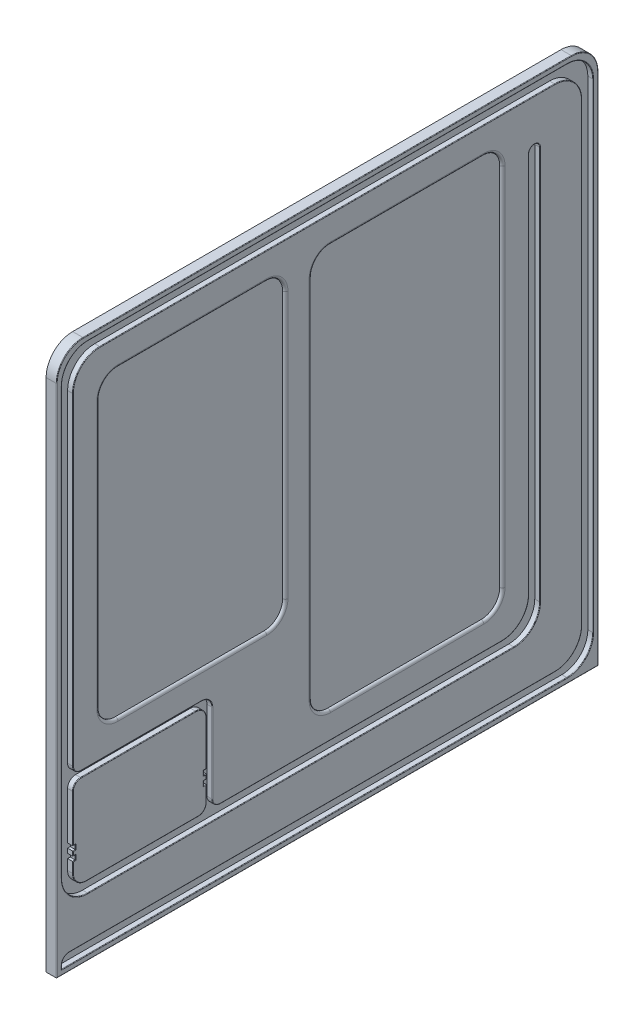
from build123d import *

# Parameters (mm, degrees)
BOSS_EXTRUDE1_DEPTH = 4
CUT_EXTRUDE3_DEPTH  = 2
FILLET1_R           = 0.2
CUT_EXTRUDE4_DEPTH  = 1
FILLET2_R           = 1


with BuildPart() as part:
    # Sketch1 → Boss-Extrude1 (new body)
    with BuildSketch(Plane(origin=(0, 0, 0), x_dir=(0, 0, -1), z_dir=(1, 0, 0))):
        with BuildLine():
            Line((-102, -102), (102, -102))
            Line((102, -102), (102, 92))
            ThreePointArc((102, 92), (99.071067812, 99.071067812), (92, 102))
            Line((92, 102), (-92, 102))
            ThreePointArc((-92, 102), (-99.071067812, 99.071067812), (-102, 92))
            Line((-102, 92), (-102, -102))
        make_face()
    extrude(amount=BOSS_EXTRUDE1_DEPTH)

    # Sketch2 → Cut-Extrude3 (cut)
    with BuildSketch(Plane(origin=(4, 0, 0), x_dir=(0, 0, -1), z_dir=(1, 0, 0))):
        with BuildLine():
            Line((-100.1, 90.3), (-100.1, -70.3))
            ThreePointArc((-100.1, -70.3), (-97.229646456, -77.229646456), (-90.3, -80.1))
            Line((-90.3, -80.1), (70.3, -80.1))
            ThreePointArc((70.3, -80.1), (77.229646456, -77.229646456), (80.1, -70.3))
            Line((80.1, -70.3), (80.1, 78))
            ThreePointArc((80.1, 78), (78, 80.1), (75.9, 78))
            Line((75.9, 78), (75.9, -65.7))
            ThreePointArc((75.9, -65.7), (72.912489168, -72.912489168), (65.7, -75.9))
            Line((65.7, -75.9), (-40.4, -75.9))
            ThreePointArc((-40.4, -75.9), (-42.521320344, -75.021320344), (-43.4, -72.9))
            Line((-43.4, -72.9), (-43.4, -42.9))
            ThreePointArc((-43.4, -42.9), (-44.571572875, -40.071572875), (-47.4, -38.9))
            Line((-47.4, -38.9), (-92.9, -38.9))
            ThreePointArc((-92.9, -38.9), (-95.021320344, -38.021320344), (-95.9, -35.9))
            Line((-95.9, -35.9), (-95.9, 85.7))
            ThreePointArc((-95.9, 85.7), (-92.912489168, 92.912489168), (-85.7, 95.9))
            Line((-85.7, 95.9), (85.7, 95.9))
            ThreePointArc((85.7, 95.9), (92.912489168, 92.912489168), (95.9, 85.7))
            Line((95.9, 85.7), (95.9, -85.7))
            ThreePointArc((95.9, -85.7), (92.912489168, -92.912489168), (85.7, -95.9))
            Line((85.7, -95.9), (-97.3, -95.9))
            ThreePointArc((-97.3, -95.9), (-99.279898987, -96.720101013), (-100.1, -98.7))
            Line((-100.1, -98.7), (-100.1, -100.1))
            Line((-100.1, -100.1), (90.3, -100.1))
            ThreePointArc((90.3, -100.1), (97.229646456, -97.229646456), (100.1, -90.3))
            Line((100.1, -90.3), (100.1, 90.3))
            ThreePointArc((100.1, 90.3), (97.229646456, 97.229646456), (90.3, 100.1))
            Line((90.3, 100.1), (-90.3, 100.1))
            ThreePointArc((-90.3, 100.1), (-97.229646456, 97.229646456), (-100.1, 90.3))
        make_face()
        with BuildLine():
            Line((-90.9, -75.9), (-48.6, -75.9))
            ThreePointArc((-48.6, -75.9), (-46.478679656, -75.021320344), (-45.6, -72.9))
            Line((-45.6, -72.9), (-45.6, -67))
            Line((-45.6, -67), (-46.6, -67))
            Line((-46.6, -67), (-46.6, -65.3))
            Line((-46.6, -65.3), (-45.6, -65.3))
            Line((-45.6, -65.3), (-45.6, -63.6))
            Line((-45.6, -63.6), (-46.6, -63.6))
            Line((-46.6, -63.6), (-46.6, -61.9))
            Line((-46.6, -61.9), (-45.6, -61.9))
            Line((-45.6, -61.9), (-45.6, -45.1))
            ThreePointArc((-45.6, -45.1), (-46.771572875, -42.271572875), (-49.6, -41.1))
            Line((-49.6, -41.1), (-92.9, -41.1))
            ThreePointArc((-92.9, -41.1), (-95.021320344, -41.978679656), (-95.9, -44.1))
            Line((-95.9, -44.1), (-95.9, -61.9))
            Line((-95.9, -61.9), (-94.9, -61.9))
            Line((-94.9, -61.9), (-94.9, -63.6))
            Line((-94.9, -63.6), (-95.9, -63.6))
            Line((-95.9, -63.6), (-95.9, -65.3))
            Line((-95.9, -65.3), (-94.9, -65.3))
            Line((-94.9, -65.3), (-94.9, -67))
            Line((-94.9, -67), (-95.9, -67))
            Line((-95.9, -67), (-95.9, -70.9))
            ThreePointArc((-95.9, -70.9), (-94.435533906, -74.435533906), (-90.9, -75.9))
        make_face(mode=Mode.SUBTRACT)
    extrude(amount=-CUT_EXTRUDE3_DEPTH, mode=Mode.SUBTRACT)

    # Fillet1
    fillet1_edges = [part.edges().sort_by_distance(p)[0] for p in [
        (4, 102, 0),
        (4, 99.071067812, 99.071067812),
        (4, -5, 102),
        (4, -102, 0),
        (4, -5, -102),
        (4, 80.1, -78),
        (4, 6.15, -75.9),
        (4, -72.912489168, -72.912489168),
        (4, -75.9, -12.65),
        (4, -75.021320344, 42.521320344),
        (4, -57.9, 43.4),
        (4, -40.071572875, 44.571572875),
        (4, -38.9, 70.15),
        (4, -38.021320344, 95.021320344),
        (4, 24.9, 95.9),
        (4, 92.912489168, 92.912489168),
        (4, 95.9, 0),
        (4, 92.912489168, -92.912489168),
        (4, 0, -95.9),
        (4, -92.912489168, -92.912489168),
        (4, -95.9, 5.8),
        (4, -96.720101013, 99.279898987),
        (4, -99.4, 100.1),
        (4, -100.1, 4.9),
        (4, -97.229646456, -97.229646456),
        (4, 0, -100.1),
        (4, 97.229646456, -97.229646456),
        (4, 100.1, 0),
        (4, 97.229646456, 97.229646456),
        (4, 10, 100.1),
        (4, -77.229646456, 97.229646456),
        (4, -80.1, 10),
        (4, -77.229646456, -77.229646456),
        (4, 3.85, -80.1),
        (4, -74.435533906, 94.435533906),
        (4, -68.95, 95.9),
        (4, -67, 95.4),
        (4, -66.15, 94.9),
        (4, -65.3, 95.4),
        (4, -64.45, 95.9),
        (4, -63.6, 95.4),
        (4, -62.75, 94.9),
        (4, -61.9, 95.4),
        (4, -53, 95.9),
        (4, -41.978679656, 95.021320344),
        (4, -41.1, 71.25),
        (4, -42.271572875, 46.771572875),
        (4, -53.5, 45.6),
        (4, -61.9, 46.1),
        (4, -62.75, 46.6),
        (4, -63.6, 46.1),
        (4, -64.45, 45.6),
        (4, -65.3, 46.1),
        (4, -66.15, 46.6),
        (4, -67, 46.1),
        (4, -69.95, 45.6),
        (4, -75.021320344, 46.478679656),
        (4, -75.9, 69.75),
        (4, 99.071067812, -99.071067812),
    ]]
    fillet(fillet1_edges, radius=FILLET1_R)

    # Sketch3 → Cut-Extrude4 (cut)
    with BuildSketch(Plane(origin=(4, 0, 0), x_dir=(0, 0, -1), z_dir=(1, 0, 0))):
        with BuildLine():
            Line((-78.9, -28.7), (-22.9, -28.7))
            ThreePointArc((-22.9, -28.7), (-17.950252532, -26.649747468), (-15.9, -21.7))
            Line((-15.9, -21.7), (-15.9, 78.7))
            ThreePointArc((-15.9, 78.7), (-17.950252532, 83.649747468), (-22.9, 85.7))
            Line((-22.9, 85.7), (-78.9, 85.7))
            ThreePointArc((-78.9, 85.7), (-83.849747468, 83.649747468), (-85.9, 78.7))
            Line((-85.9, 78.7), (-85.9, -21.7))
            ThreePointArc((-85.9, -21.7), (-83.849747468, -26.649747468), (-78.9, -28.7))
        make_face()
        with BuildLine():
            Line((1.1, -65.9), (58.9, -65.9))
            ThreePointArc((58.9, -65.9), (63.849747468, -63.849747468), (65.9, -58.9))
            Line((65.9, -58.9), (65.9, 78.7))
            ThreePointArc((65.9, 78.7), (63.849747468, 83.649747468), (58.9, 85.7))
            Line((58.9, 85.7), (1.1, 85.7))
            ThreePointArc((1.1, 85.7), (-3.849747468, 83.649747468), (-5.9, 78.7))
            Line((-5.9, 78.7), (-5.9, -58.9))
            ThreePointArc((-5.9, -58.9), (-3.849747468, -63.849747468), (1.1, -65.9))
        make_face()
    extrude(amount=-CUT_EXTRUDE4_DEPTH, mode=Mode.SUBTRACT)

    # Fillet2
    fillet2_edges = [part.edges().sort_by_distance(p)[0] for p in [
        (4, 83.649747468, -63.849747468),
        (4, 9.9, -65.9),
        (4, -63.849747468, -63.849747468),
        (4, -65.9, -30),
        (4, -63.849747468, 3.849747468),
        (4, 9.9, 5.9),
        (4, 83.649747468, 3.849747468),
        (4, 83.649747468, 17.950252532),
        (4, 28.5, 15.9),
        (4, -26.649747468, 17.950252532),
        (4, -28.7, 50.9),
        (4, -26.649747468, 83.849747468),
        (4, 28.5, 85.9),
        (4, 83.649747468, 83.849747468),
        (4, 85.7, -30),
        (4, 85.7, 50.9),
    ]]
    fillet(fillet2_edges, radius=FILLET2_R - 0.0001)  # a hair under: the kernel refuses the full size


solid = part.part
